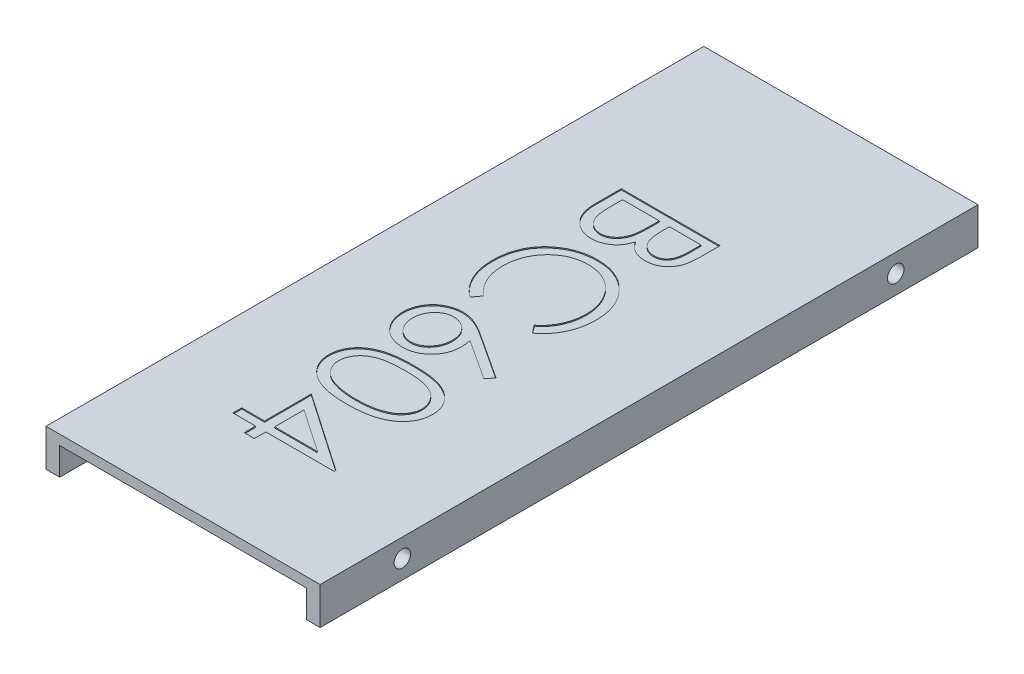
from build123d import *

# Parameters (mm, degrees)
BOSS_EXTRUDE1_DEPTH     = 1200
CUT_EXTRUDE1_DEPTH      = 1239.388983667
CUT_EXTRUDE1_DEPTH_BACK = 1239.388983667
SKETCH4_R               = 15
CUT_EXTRUDE2_DEPTH      = 1239.388983667
CUT_EXTRUDE2_DEPTH_BACK = 1239.388983667
SKETCH4_3_R             = 15
CUT_EXTRUDE3_DEPTH      = 2
CUT_EXTRUDE4_DEPTH      = 2


with BuildPart() as part:
    # Sketch2 → Boss-Extrude1 (new body)
    with BuildSketch(Plane.XY):
        Polygon((-251.282051282, 174.541128592), (248.717948718, 174.541128592), (248.717948718, 156.541128592), (248.717948718, 106.541128592), (223.717948718, 106.541128592), (223.717948718, 156.541128592), (-226.282051282, 156.541128592), (-226.282051282, 106.541128592), (-251.282051282, 106.541128592), (-251.282051282, 156.541128592), align=None)
    extrude(amount=BOSS_EXTRUDE1_DEPTH)

    # Sketch4 → Cut-Extrude1 (cut, two sides: drawn at the far end of the back side and taken through both)
    with BuildSketch(Plane(origin=(0, 0, 0), x_dir=(0, 0, -1), z_dir=(1, 0, 0)).offset(-CUT_EXTRUDE1_DEPTH_BACK)):
        with Locations((-1050, 140.541128592)):
            Circle(SKETCH4_R)
    extrude(amount=CUT_EXTRUDE1_DEPTH + CUT_EXTRUDE1_DEPTH_BACK, mode=Mode.SUBTRACT)

    # Sketch4<3> → Cut-Extrude2 (cut, two sides: drawn at the far end of the back side and taken through both)
    with BuildSketch(Plane(origin=(0, 0, 0), x_dir=(0, 0, -1), z_dir=(1, 0, 0)).offset(-CUT_EXTRUDE2_DEPTH_BACK)):
        with Locations((-150, 140.541128592)):
            Circle(SKETCH4_3_R)
    extrude(amount=CUT_EXTRUDE2_DEPTH + CUT_EXTRUDE2_DEPTH_BACK, mode=Mode.SUBTRACT)

    # Sketch10 → Cut-Extrude3 (cut)
    # profile 1 of 5: a face of its own
    with BuildSketch(Plane(origin=(0, 174.541128592, 0), x_dir=(1, 0, 0), z_dir=(0, 1, 0))):
        with BuildLine():
            Line((78.146190481, -300.04491907), (78.146190481, -335.165111378))
            add(Edge.make_bspline(
                [(78.146190481, -335.165111378), (78.137151889, -336.884290256), (78.119632848, -340.216486787), (77.84792896, -345.062058082), (77.477454509, -349.600568343), (76.889621173, -353.833333778), (76.180329777, -357.758398473), (75.321379235, -361.387591245), (74.291439104, -364.709371533), (72.653630355, -368.675169405), (70.219867411, -373.196803393), (66.623541204, -378.092720732), (62.224728815, -382.279224471), (57.262763679, -385.8888065), (51.80435256, -388.758578366), (45.97959428, -390.834713657), (39.863618981, -392.149118675), (35.664826976, -392.284295292), (33.542825096, -392.352611378)],
                knots=[0, 0, 0, 0, 1.001505555, 1.941167018, 2.826882275, 3.653841531, 4.429895133, 5.150066043, 5.825578002, 6.45369114, 7.647487171, 8.808567382, 9.977351308, 11.170798116, 12.373658725, 13.556498008, 14.765093433, 16, 16, 16, 16], degree=3))
            add(Edge.make_bspline(
                [(33.542825096, -392.352611378), (31.554642564, -392.297475334), (27.647676393, -392.189127808), (21.942511139, -391.117785689), (16.489305649, -389.522710094), (11.355286662, -387.20713163), (6.606437457, -384.228581148), (2.270980235, -380.644239428), (-1.546018812, -376.376612054), (-3.671033142, -373.174069448), (-4.750444135, -371.547322916)],
                knots=[0, 0, 0, 0, 1.044266239, 2.052081639, 3.041743201, 4.026043445, 5.00270663, 5.980942822, 6.97441044, 8, 8, 8, 8], degree=3))
            add(Edge.make_bspline(
                [(-4.750444135, -371.547322916), (-5.534895397, -373.592487364), (-7.035744986, -377.505393579), (-9.703667422, -382.8939412), (-12.572726976, -387.555154482), (-15.722466917, -391.494164039), (-19.160007854, -394.812170025), (-22.81651492, -397.791808261), (-26.872003078, -400.288077055), (-31.210995112, -402.432582364), (-35.803037831, -404.120285559), (-40.627130054, -405.314446312), (-45.629329694, -406.048199974), (-49.038837045, -406.148254614), (-50.760059519, -406.198765224)],
                knots=[0, 0, 0, 0, 1.272302504, 2.434229863, 3.488457646, 4.447234501, 5.35599188, 6.26022912, 7.18267843, 8.11661068, 9.06895546, 10.019249207, 11.000057067, 12, 12, 12, 12], degree=3))
            add(Edge.make_bspline(
                [(-50.760059519, -406.198765224), (-52.517202979, -406.148511661), (-55.974431963, -406.049636369), (-61.053409765, -405.320605874), (-65.906455435, -404.085024166), (-70.568074829, -402.387267407), (-75.01188155, -400.158891413), (-79.293530547, -397.505476298), (-83.298961583, -394.275933825), (-87.123428233, -390.676151579), (-90.560058808, -386.59901095), (-93.619614283, -382.200733576), (-96.147328006, -377.418057754), (-98.244128296, -372.325150131), (-99.869137809, -366.888168175), (-100.997294776, -361.127270907), (-101.75921832, -355.041206432), (-101.821744111, -350.864674882), (-101.853809519, -348.722803685)],
                knots=[0, 0, 0, 0, 0.978404568, 1.925038397, 2.85041836, 3.763147166, 4.682162379, 5.614488577, 6.562659439, 7.54271123, 8.535210642, 9.526693784, 10.520907202, 11.541451354, 12.589717429, 13.675358278, 14.807842563, 16, 16, 16, 16], degree=3))
            Line((-101.853809519, -348.722803685), (-101.853809519, -300.04491907))
            Line((-101.853809519, -300.04491907), (78.146190481, -300.04491907))
        make_face()
        with BuildLine():
            Line((59.684652019, -316.198765224), (1.992344327, -316.198765224))
            Line((1.992344327, -316.198765224), (1.992344327, -327.052130608))
            add(Edge.make_bspline(
                [(1.992344327, -327.052130608), (2.012740642, -328.63865437), (2.05215048, -331.704141593), (2.168599084, -336.155247993), (2.480381589, -340.276595815), (2.810143025, -344.082386479), (3.317908156, -347.547111925), (3.939270014, -350.682371106), (4.590672086, -353.516328478), (5.701591112, -356.783018278), (7.326766392, -360.487401204), (9.908212222, -364.411314459), (12.899379515, -367.926728046), (16.414448564, -370.862054075), (20.252125245, -373.284211145), (24.412751665, -374.90065365), (28.733898368, -376.047175078), (31.708191118, -376.147717563), (33.218305865, -376.198765224)],
                knots=[0, 0, 0, 0, 1.156481963, 2.23455883, 3.244418989, 4.168404366, 5.01828131, 5.794834307, 6.498111525, 7.13526334, 8.307595709, 9.435046769, 10.546766856, 11.659452936, 12.760769924, 13.837671619, 14.902137667, 16, 16, 16, 16], degree=3))
            add(Edge.make_bspline(
                [(33.218305865, -376.198765224), (34.217816075, -376.173234142), (36.178464499, -376.123152137), (39.025629028, -375.667346349), (41.737653684, -375.005967717), (44.25216376, -373.972692522), (46.640628838, -372.72324923), (48.796961191, -371.097950265), (50.839297556, -369.262436648), (52.692648407, -367.106804568), (54.353258025, -364.641491722), (55.814448831, -361.843008211), (56.967077926, -358.677938688), (58.001047584, -355.218047551), (58.718509843, -351.407962296), (59.318403841, -347.28491266), (59.623346562, -342.813921557), (59.663761065, -339.720753874), (59.684652019, -338.121842147)],
                knots=[0, 0, 0, 0, 0.911752476, 1.788502045, 2.626783689, 3.45400582, 4.26402138, 5.080402872, 5.911472738, 6.767166405, 7.66795952, 8.620018292, 9.640966946, 10.73819047, 11.913090943, 13.176185384, 14.540321519, 16, 16, 16, 16], degree=3))
            Line((59.684652019, -338.121842147), (59.684652019, -316.198765224))
        make_face(mode=Mode.SUBTRACT)
        with BuildLine():
            Line((-16.469194135, -316.198765224), (-83.392271058, -316.198765224))
            Line((-83.392271058, -316.198765224), (-83.392271058, -339.203572916))
            add(Edge.make_bspline(
                [(-83.392271058, -339.203572916), (-83.372604407, -340.850268699), (-83.33469953, -344.024057733), (-83.20960499, -348.606298043), (-82.931038039, -352.84187125), (-82.476899615, -356.733214658), (-82.005010221, -360.31458269), (-81.351892482, -363.550394358), (-80.60937658, -366.445610416), (-79.460298051, -369.802260223), (-77.678231305, -373.58449046), (-74.97375424, -377.657571628), (-71.79421265, -381.315031314), (-68.067907037, -384.385285533), (-64.046862306, -386.920581078), (-59.752109883, -388.698731772), (-55.31466984, -389.842057189), (-52.28131926, -389.977162316), (-50.760059519, -390.04491907)],
                knots=[0, 0, 0, 0, 1.159821618, 2.235403267, 3.228114831, 4.14795534, 4.994323282, 5.771256229, 6.471395042, 7.097801288, 8.267864287, 9.404187171, 10.531774336, 11.667624178, 12.792825787, 13.866573821, 14.930062559, 16, 16, 16, 16], degree=3))
            add(Edge.make_bspline(
                [(-50.760059519, -390.04491907), (-49.808850388, -390.0310698), (-47.921775214, -390.003594651), (-45.150755565, -389.573654821), (-42.454582343, -388.973860711), (-39.87402563, -388.105307285), (-37.367094245, -387.010131795), (-34.977455008, -385.635728108), (-32.647970771, -384.04855224), (-29.706360083, -381.565684728), (-26.315971326, -377.957718928), (-22.997023822, -372.829647938), (-20.320244429, -366.999155628), (-19.183704921, -362.770301313), (-18.596597981, -360.585784455)],
                knots=[0, 0, 0, 0, 0.723503378, 1.435336582, 2.130201219, 2.824764462, 3.504949994, 4.209866579, 4.920640069, 5.648298893, 7.13757748, 8.670694625, 10.280166878, 12, 12, 12, 12], degree=3))
            add(Edge.make_bspline(
                [(-18.596597981, -360.585784455), (-18.418896005, -359.7100032), (-18.033601468, -357.811128796), (-17.627149259, -354.714723215), (-17.262548395, -351.167882191), (-16.999933916, -347.185765547), (-16.718021857, -342.752535892), (-16.612287641, -337.869617446), (-16.483233445, -332.533558181), (-16.473993617, -328.831088783), (-16.469194135, -326.907899839)],
                knots=[0, 0, 0, 0, 0.634452549, 1.375623993, 2.216454381, 3.166361212, 4.209414599, 5.370755378, 6.634280627, 8, 8, 8, 8], degree=3))
            Line((-16.469194135, -326.907899839), (-16.469194135, -316.198765224))
        make_face(mode=Mode.SUBTRACT)
    # profile 2 of 5: a face of its own
    with BuildSketch(Plane(origin=(0, 174.541128592, 0), x_dir=(1, 0, 0), z_dir=(0, 1, 0))):
        with BuildLine():
            Line((45.117344327, -609.275688301), (34.300036634, -595.141072916))
            add(Edge.make_bspline(
                [(34.300036634, -595.141072916), (35.501715083, -594.132770086), (37.888870749, -592.129758535), (41.240961607, -588.907285263), (44.381460766, -585.548915057), (47.325328862, -582.05593168), (49.969619671, -578.365462678), (52.452133536, -574.566907318), (54.677331488, -570.596722136), (57.375427917, -565.106632925), (60.19094446, -557.924743585), (62.55168207, -548.883866147), (64.054485391, -539.446152511), (64.217248666, -533.007418816), (64.300036634, -529.73241907)],
                knots=[0, 0, 0, 0, 0.757959112, 1.505699292, 2.245454638, 2.979532153, 3.711538275, 4.438200793, 5.171680507, 5.909471876, 7.393775596, 8.890124382, 10.418191784, 12, 12, 12, 12], degree=3))
            add(Edge.make_bspline(
                [(64.300036634, -529.73241907), (64.279167677, -527.928157036), (64.237623446, -524.33637822), (63.693394735, -519.005561632), (62.919665439, -513.764191366), (61.799531636, -508.631758221), (60.34121905, -503.618452877), (58.631007645, -498.686103166), (56.502823112, -493.892799003), (54.15252742, -489.180854209), (51.497125227, -484.666703207), (48.601683077, -480.394635806), (45.494619312, -476.38416906), (42.183954184, -472.624189863), (38.628542794, -469.155934515), (34.870210343, -465.923819049), (30.863720628, -462.986093805), (26.684211993, -460.270569302), (22.325541372, -457.854238175), (17.815128438, -455.767619253), (13.170218131, -453.979213346), (8.381295054, -452.550972436), (3.467204783, -451.424429607), (-1.582481489, -450.646162626), (-6.757962051, -450.106829751), (-10.2658649, -450.065667685), (-12.034097981, -450.04491907)],
                knots=[0, 0, 0, 0, 1.055000685, 2.100209969, 3.131349012, 4.153242145, 5.170189196, 6.184191144, 7.204341339, 8.235672124, 9.263040994, 10.265373269, 11.252624173, 12.22887325, 13.193405896, 14.155809299, 15.126090485, 16.097288279, 17.069732292, 18.038585918, 19.002221264, 19.978698174, 20.959418239, 21.948869816, 22.966084182, 24, 24, 24, 24], degree=3))
            add(Edge.make_bspline(
                [(-12.034097981, -450.04491907), (-14.694565863, -450.10981262), (-19.918041655, -450.237222497), (-27.569101626, -451.371136821), (-34.898736277, -453.094255802), (-41.861128167, -455.676771187), (-48.542129439, -458.861179502), (-54.828699043, -462.884982379), (-60.815836646, -467.545261443), (-66.362045388, -472.907945873), (-71.428465546, -478.791673552), (-75.889924023, -485.104423291), (-79.608975122, -491.830472377), (-82.703738085, -498.895556216), (-85.082655508, -506.354042074), (-86.757381859, -514.192517627), (-87.849836859, -522.393934526), (-87.954426531, -527.998075091), (-88.007655673, -530.850207531)],
                knots=[0, 0, 0, 0, 1.029171465, 2.020641659, 2.987623507, 3.938342917, 4.889210282, 5.84687017, 6.821220943, 7.821438502, 8.827599549, 9.822697543, 10.807740252, 11.797342354, 12.80366471, 13.83203677, 14.896651826, 16, 16, 16, 16], degree=3))
            add(Edge.make_bspline(
                [(-88.007655673, -530.850207531), (-87.920804143, -533.992631537), (-87.749859555, -540.17767371), (-86.301669601, -549.24802935), (-83.953548112, -557.931011583), (-80.66736925, -566.227087462), (-76.395440158, -574.112869267), (-71.216692177, -581.600697511), (-65.081863635, -588.696892566), (-60.397588467, -592.963987081), (-58.007655673, -595.141072916)],
                knots=[0, 0, 0, 0, 1.028121516, 2.023589091, 2.998037872, 3.967518031, 4.937445131, 5.927275754, 6.942489185, 8, 8, 8, 8], degree=3))
            Line((-58.007655673, -595.141072916), (-68.716790289, -609.275688301))
            add(Edge.make_bspline(
                [(-68.716790289, -609.275688301), (-70.18448461, -608.138187017), (-73.112843081, -605.868633016), (-77.241065231, -602.193626891), (-81.12426891, -598.322306683), (-84.730315127, -594.225416046), (-88.134483836, -589.951953824), (-91.222653001, -585.426645115), (-94.088893191, -580.727650794), (-96.67865269, -575.827612616), (-99.000656278, -570.742618054), (-100.960955906, -565.477958976), (-102.673892145, -560.078237869), (-104.07378911, -554.540735401), (-105.168174621, -548.846952304), (-105.899350278, -543.016424078), (-106.40039593, -537.036843103), (-106.446055673, -533.00271115), (-106.469194135, -530.958380608)],
                knots=[0, 0, 0, 0, 0.986756325, 1.968786143, 2.935506311, 3.899499537, 4.868307269, 5.8376204, 6.809456583, 7.792545619, 8.781780509, 9.778496008, 10.776623214, 11.79151764, 12.812666265, 13.856269958, 14.913646641, 16, 16, 16, 16], degree=3))
            add(Edge.make_bspline(
                [(-106.469194135, -530.958380608), (-106.455720232, -529.022420588), (-106.429077257, -525.194299383), (-105.997480076, -519.542363586), (-105.408636464, -514.040042288), (-104.522001152, -508.703061529), (-103.475720806, -503.502297098), (-102.073199037, -498.48489561), (-100.502099041, -493.601484791), (-98.655556865, -488.871684413), (-96.571867478, -484.29147128), (-94.21687302, -479.875618124), (-91.610377123, -475.626155887), (-88.80983373, -471.501305671), (-85.725286776, -467.562001368), (-82.399574145, -463.774105779), (-78.84390502, -460.11637843), (-76.279941134, -457.853383201), (-74.99082875, -456.715592147)],
                knots=[0, 0, 0, 0, 1.114604814, 2.203992996, 3.262667896, 4.300477797, 5.318619304, 6.316056647, 7.298880507, 8.271930387, 9.238335007, 10.195173496, 11.151986948, 12.108099108, 13.064862484, 14.031167946, 15.010108607, 16, 16, 16, 16], degree=3))
            add(Edge.make_bspline(
                [(-74.99082875, -456.715592147), (-72.751567606, -454.893187624), (-68.300079642, -451.270380244), (-61.085372034, -446.63534509), (-53.552721292, -442.667756537), (-45.662553526, -439.459852039), (-37.432573611, -436.952054334), (-28.85863287, -435.21473573), (-19.9487387, -434.085796071), (-13.888560997, -433.956695506), (-10.808136442, -433.891072916)],
                knots=[0, 0, 0, 0, 0.994628077, 1.977248131, 2.950237994, 3.925870899, 4.908910175, 5.911660606, 6.938484602, 8, 8, 8, 8], degree=3))
            add(Edge.make_bspline(
                [(-10.808136442, -433.891072916), (-7.570562862, -433.971412034), (-1.200838964, -434.129474233), (8.149469143, -435.461295021), (17.094834897, -437.629756552), (25.669677939, -440.61574253), (33.824936266, -444.555056397), (41.595052984, -449.323914415), (48.973683569, -454.968896804), (55.866491537, -461.419107975), (62.168347484, -468.494372232), (67.712710432, -476.070670924), (72.326742537, -484.133768177), (76.183691139, -492.594679369), (79.148262686, -501.516802008), (81.223569662, -510.881089047), (82.515307007, -520.669947664), (82.678603422, -527.348586678), (82.761575096, -530.742034455)],
                knots=[0, 0, 0, 0, 1.032901378, 2.032168977, 3.007206631, 3.966850309, 4.924221947, 5.891988639, 6.871730993, 7.884084801, 8.900290346, 9.89161143, 10.874607481, 11.860025555, 12.854717796, 13.869097222, 14.917278314, 16, 16, 16, 16], degree=3))
            add(Edge.make_bspline(
                [(82.761575096, -530.742034455), (82.736797947, -532.81021135), (82.687754075, -536.903959231), (82.208883891, -542.959751189), (81.412028747, -548.855858238), (80.320283323, -554.606539297), (78.982169408, -560.232647513), (77.230474882, -565.67646323), (75.196328111, -570.967630063), (72.913290121, -576.110110809), (70.303254603, -581.047956815), (67.468482434, -585.780269476), (64.3435376, -590.249962094), (61.031730866, -594.541109885), (57.409178914, -598.557105531), (53.593852962, -602.412644874), (49.472538922, -605.974543062), (46.571733337, -608.173292242), (45.117344327, -609.275688301)],
                knots=[0, 0, 0, 0, 1.096705196, 2.170817488, 3.219277236, 4.250701065, 5.274195539, 6.284202015, 7.28098643, 8.279664616, 9.266225751, 10.241373748, 11.203306326, 12.157093976, 13.114198862, 14.069774147, 15.032234603, 16, 16, 16, 16], degree=3))
        make_face()
    # profile 3 of 5: a face of its own
    with BuildSketch(Plane(origin=(0, 174.541128592, 0), x_dir=(1, 0, 0), z_dir=(0, 1, 0))):
        with BuildLine():
            Line((82.761575096, -713.121842147), (72.989940481, -725.561745993))
            Line((72.989940481, -725.561745993), (0.261575096, -678.001649839))
            add(Edge.make_bspline(
                [(0.261575096, -678.001649839), (0.76628793, -681.168121227), (1.750787378, -687.34468169), (1.913196001, -693.596642185), (1.992344327, -696.643476762)],
                knots=[0, 0, 0, 0, 1.025318673, 2, 2, 2, 2], degree=3))
            add(Edge.make_bspline(
                [(1.992344327, -696.643476762), (1.943172868, -698.472919431), (1.846380315, -702.074122883), (1.101496565, -707.361329852), (-0.072366334, -712.441903702), (-1.783510925, -717.294786618), (-3.969346293, -721.937397114), (-6.589059621, -726.396377485), (-9.777923182, -730.587909433), (-13.340120908, -734.565970078), (-17.285565825, -738.177649373), (-21.471920285, -741.375275087), (-25.894822736, -744.061224376), (-30.552032984, -746.240454631), (-35.436372047, -747.93270553), (-40.541590649, -749.166355847), (-45.871209181, -749.895592049), (-49.495801052, -749.994617286), (-51.336982596, -750.04491907)],
                knots=[0, 0, 0, 0, 1.04369286, 2.054478336, 3.041073146, 4.015093852, 4.984733326, 5.965804835, 6.960378782, 7.985147595, 9.009457201, 10.008161701, 10.986880575, 11.956520048, 12.937015923, 13.931873656, 14.949455224, 16, 16, 16, 16], degree=3))
            add(Edge.make_bspline(
                [(-51.336982596, -750.04491907), (-53.854441391, -749.95098331), (-58.805283657, -749.766248952), (-66.046293554, -748.421461292), (-72.88928098, -746.100658257), (-79.361137747, -742.995702095), (-85.273564803, -738.967265621), (-90.616813447, -734.193346918), (-95.274239575, -728.628819109), (-99.269651438, -722.405451441), (-102.444001132, -715.669834905), (-104.790862653, -708.607320642), (-106.193172054, -701.278275212), (-106.376763565, -696.30084495), (-106.469194135, -693.79491907)],
                knots=[0, 0, 0, 0, 1.031881447, 2.029301251, 3.006342947, 3.987068354, 4.962916383, 5.929513747, 6.915671209, 7.928552063, 8.953527267, 9.960179832, 10.973036711, 12, 12, 12, 12], degree=3))
            add(Edge.make_bspline(
                [(-106.469194135, -693.79491907), (-106.390600895, -691.372802569), (-106.234921447, -686.575013861), (-104.848098883, -679.517334131), (-102.600316013, -672.735781665), (-99.503540328, -666.27802514), (-95.592145916, -660.295460062), (-90.882661509, -654.944848052), (-85.479172119, -650.244805011), (-79.365101818, -646.35400093), (-72.83744487, -643.182985044), (-65.968931821, -640.946421684), (-58.897794221, -639.500030322), (-54.084387944, -639.350803448), (-51.661501827, -639.275688301)],
                knots=[0, 0, 0, 0, 1.011913813, 2.004424092, 2.994488568, 3.992479987, 4.990471406, 5.973328987, 6.963763268, 7.974390938, 8.994854117, 9.989689954, 10.988086187, 12, 12, 12, 12], degree=3))
            add(Edge.make_bspline(
                [(-51.661501827, -639.275688301), (-49.808455351, -639.340922785), (-46.026572179, -639.474059865), (-40.282235291, -640.268606622), (-34.427577709, -641.72590245), (-29.464429832, -643.303015046), (-25.354044175, -644.86798682), (-22.108181202, -646.319064658), (-18.680445681, -647.94154649), (-15.135693741, -649.843321145), (-11.37264414, -651.859355753), (-7.530654094, -654.214312954), (-3.469402263, -656.67174698), (-0.765483878, -658.4720005), (0.622152019, -659.395880608)],
                knots=[0, 0, 0, 0, 1.17367173, 2.395347028, 3.66355231, 4.98980831, 5.690886799, 6.447442954, 7.240630024, 8.091733897, 8.994365608, 9.943299771, 10.944512865, 12, 12, 12, 12], degree=3))
            Line((0.622152019, -659.395880608), (82.761575096, -713.121842147))
        make_face()
        with BuildLine():
            add(Edge.make_bspline(
                [(-16.469194135, -693.254053685), (-16.509737869, -691.882895545), (-16.589284343, -689.192694566), (-17.038563397, -685.25075982), (-17.889824031, -681.530047777), (-18.990949258, -677.988061839), (-20.490208306, -674.661718798), (-22.289744211, -671.513074962), (-24.429274764, -668.573374009), (-26.884944724, -665.894242185), (-29.534275238, -663.434137493), (-32.388946086, -661.318045724), (-35.361742084, -659.490714391), (-38.480603906, -658.005486306), (-41.743530923, -656.848820911), (-45.135730626, -656.012176957), (-48.679892316, -655.546553053), (-51.083278534, -655.469090052), (-52.310540289, -655.429534455)],
                knots=[0, 0, 0, 0, 1.129474985, 2.216020618, 3.260639938, 4.268601163, 5.26556745, 6.258792394, 7.250684778, 8.252748164, 9.247500881, 10.223461414, 11.174097059, 12.117127289, 13.062595836, 14.020469732, 14.98917545, 16, 16, 16, 16], degree=3))
            add(Edge.make_bspline(
                [(-52.310540289, -655.429534455), (-53.526778671, -655.461830331), (-55.911641077, -655.525157738), (-59.426888127, -656.097521169), (-62.806605357, -656.978053767), (-66.053264721, -658.266920178), (-69.149156201, -659.883535512), (-72.116270817, -661.872958936), (-74.956656542, -664.201504707), (-77.598688928, -666.908392964), (-80.022025237, -669.827509512), (-82.179768436, -672.914668609), (-83.991695737, -676.160054287), (-85.424167087, -679.582185027), (-86.597395272, -683.133148326), (-87.423577166, -686.840033285), (-87.890531563, -690.706096954), (-87.968101887, -693.32493519), (-88.007655673, -694.660303685)],
                knots=[0, 0, 0, 0, 0.989642335, 1.94054129, 2.892446913, 3.828371744, 4.778262963, 5.730973156, 6.732161388, 7.763274768, 8.805796303, 9.818398792, 10.825975928, 11.825728216, 12.834635236, 13.867465554, 14.912602056, 16, 16, 16, 16], degree=3))
            add(Edge.make_bspline(
                [(-88.007655673, -694.660303685), (-87.968104988, -695.995674368), (-87.890540746, -698.614516895), (-87.423542266, -702.480549465), (-86.597523333, -706.187549388), (-85.423702866, -709.738094849), (-83.993417846, -713.161767984), (-82.168414642, -716.409994491), (-80.035144462, -719.526627763), (-77.594518075, -722.443829287), (-74.971585259, -725.162031579), (-72.090553083, -727.436037707), (-69.172738401, -729.488311523), (-66.04092776, -731.0428372), (-62.808559822, -732.346057558), (-59.426364533, -733.222147506), (-55.911778155, -733.795695385), (-53.526824968, -733.85886004), (-52.310540289, -733.891072916)],
                knots=[0, 0, 0, 0, 1.087205562, 2.132157158, 3.164804748, 4.173533273, 5.173108684, 6.180507559, 7.20098426, 8.243321352, 9.274252308, 10.269075238, 11.227079059, 12.172305571, 13.108064818, 14.05980203, 15.010532752, 16, 16, 16, 16], degree=3))
            add(Edge.make_bspline(
                [(-52.310540289, -733.891072916), (-51.081535035, -733.863101991), (-48.669397415, -733.808204161), (-45.138923783, -733.175255155), (-41.715946735, -732.320352182), (-38.477574352, -730.938750621), (-35.334252612, -729.29315039), (-32.375819999, -727.196763794), (-29.518463585, -724.79320525), (-26.867373938, -722.009651234), (-24.442471578, -718.981393652), (-22.302088874, -715.761062401), (-20.495647916, -712.392107515), (-18.98842914, -708.877783371), (-17.900740913, -705.177865623), (-17.044288683, -701.35207622), (-16.588527698, -697.351486743), (-16.509478643, -694.637261153), (-16.469194135, -693.254053685)],
                knots=[0, 0, 0, 0, 0.978265087, 1.920016216, 2.851775529, 3.783928695, 4.718195979, 5.674835085, 6.667117013, 7.690134047, 8.732874136, 9.755756613, 10.767227014, 11.776017537, 12.797239016, 13.836276431, 14.897336092, 16, 16, 16, 16], degree=3))
        make_face(mode=Mode.SUBTRACT)
    # profile 4 of 5: a face of its own
    with BuildSketch(Plane(origin=(0, 174.541128592, 0), x_dir=(1, 0, 0), z_dir=(0, 1, 0))):
        with BuildLine():
            add(Edge.make_bspline(
                [(-11.925924904, -768.506457531), (-9.040916391, -768.523327036), (-3.436745771, -768.556096291), (4.729321525, -768.920643665), (12.390136423, -769.52623266), (19.546065414, -770.356154823), (26.198956564, -771.366107651), (32.33102843, -772.71433416), (37.970669891, -774.247559035), (43.136245665, -776.024558682), (47.897437335, -778.029587397), (52.341976272, -780.212123857), (56.464219827, -782.657593297), (60.326095078, -785.23040845), (63.884501668, -788.024586816), (67.132700833, -791.010656681), (70.0726539, -794.21823868), (72.739351299, -797.583894131), (75.062384683, -801.128893032), (77.155592175, -804.743954903), (78.873615561, -808.492870426), (80.285279434, -812.341448317), (81.416409924, -816.278496493), (82.199715599, -820.32028254), (82.690637684, -824.467782892), (82.737704951, -827.267082398), (82.761575096, -828.686745993)],
                knots=[0, 0, 0, 0, 1.646377244, 3.198111528, 4.663803227, 6.031090796, 7.308794487, 8.502186765, 9.612154809, 10.642545331, 11.617106989, 12.558866172, 13.465886467, 14.35053239, 15.20542558, 16.045215227, 16.865619885, 17.686225247, 18.492864914, 19.282407821, 20.068097601, 20.842842034, 21.620163247, 22.403093475, 23.190129512, 24, 24, 24, 24], degree=3))
            add(Edge.make_bspline(
                [(82.761575096, -828.686745993), (82.736487458, -830.118284887), (82.68659604, -832.965165344), (82.207078996, -837.174098928), (81.411421237, -841.285796845), (80.284056829, -845.282729692), (78.88542203, -849.197728996), (77.132370293, -853.000172818), (75.091742829, -856.713679874), (72.693943425, -860.279237518), (70.020569221, -863.735989164), (66.998489111, -866.99902726), (63.658217834, -870.068648821), (60.035493406, -872.983378812), (56.0608319, -875.660523811), (51.803363395, -878.210014611), (47.188633206, -880.492005029), (42.293637717, -882.689788324), (36.982935264, -884.586833356), (31.286461866, -886.297668827), (25.136932256, -887.680015783), (18.56661107, -888.831464074), (11.551369074, -889.723487295), (4.106244277, -890.37316603), (-3.773661528, -890.716353261), (-9.161208057, -890.780983608), (-11.925924904, -890.814149839)],
                knots=[0, 0, 0, 0, 0.810914788, 1.612654377, 2.396697861, 3.181598691, 3.963628158, 4.749916497, 5.551656086, 6.361998678, 7.18212741, 8.025565596, 8.878627764, 9.750805457, 10.657531673, 11.591944965, 12.560506719, 13.57287815, 14.630710178, 15.753379473, 16.941251878, 18.199788006, 19.531962791, 20.947069417, 22.433333509, 24, 24, 24, 24], degree=3))
            add(Edge.make_bspline(
                [(-11.925924904, -890.814149839), (-14.678572734, -890.78059836), (-20.041994776, -890.715224672), (-27.88658713, -890.377463381), (-35.291701215, -889.709009198), (-42.27795005, -888.882236851), (-48.803854028, -887.704511036), (-54.931466603, -886.365644343), (-60.607907463, -884.701576773), (-65.890601706, -882.830388541), (-70.761614884, -880.680294965), (-75.336452911, -878.378135978), (-79.590447486, -875.844294475), (-83.565051212, -873.151183586), (-87.21919408, -870.261228446), (-90.561907153, -867.178608848), (-93.590985617, -863.900978433), (-96.300886497, -860.436411441), (-98.670773835, -856.814762553), (-100.789071936, -853.113650734), (-102.507939476, -849.259205087), (-103.959212673, -845.337087579), (-105.089170627, -841.310290462), (-105.862845211, -837.182763485), (-106.406956554, -832.968024142), (-106.44837644, -830.118780159), (-106.469194135, -828.686745993)],
                knots=[0, 0, 0, 0, 1.56130642, 3.042141888, 4.451772327, 5.777565838, 7.030558081, 8.211376819, 9.333164717, 10.383253789, 11.387583522, 12.350962576, 13.286244149, 14.193812918, 15.072134482, 15.925989337, 16.770211267, 17.600669898, 18.417446232, 19.22325363, 20.01647746, 20.807971184, 21.593601364, 22.38506573, 23.188331689, 24, 24, 24, 24], degree=3))
            add(Edge.make_bspline(
                [(-106.469194135, -828.686745993), (-106.44509429, -827.267140074), (-106.397574101, -824.467954292), (-105.909969827, -820.31962087), (-105.114851547, -816.284138394), (-104.035084871, -812.353439645), (-102.662765453, -808.519480354), (-100.917225991, -804.819817947), (-98.892671765, -801.205592615), (-96.589362463, -797.693296161), (-93.949829984, -794.349870878), (-91.030585459, -791.156160873), (-87.758408291, -788.192806105), (-84.18567468, -785.4336477), (-80.342699297, -782.81535619), (-76.191625944, -780.393850568), (-71.705444309, -778.215571245), (-66.917969363, -776.165608174), (-61.714429194, -774.358569602), (-56.0447082, -772.774417021), (-49.877442839, -771.453804236), (-43.230941874, -770.391760598), (-36.100230665, -769.516212462), (-28.472754207, -768.923511203), (-20.355093279, -768.555805968), (-14.786920331, -768.523207185), (-11.925924904, -768.506457531)],
                knots=[0, 0, 0, 0, 0.810940842, 1.599017053, 2.38298203, 3.159479784, 3.926441347, 4.70693857, 5.494146311, 6.292334103, 7.104379492, 7.925868426, 8.762126819, 9.623561095, 10.503686106, 11.41783325, 12.366995289, 13.351843594, 14.392337808, 15.512229747, 16.713911458, 17.994391108, 19.357476964, 20.818259213, 22.365182633, 24, 24, 24, 24], degree=3))
        make_face()
        with BuildLine():
            add(Edge.make_bspline(
                [(-11.853809519, -784.660303685), (-14.258028316, -784.666446676), (-18.924144907, -784.678369016), (-25.70465546, -784.989830773), (-32.028843838, -785.414128375), (-37.90473987, -785.961395232), (-43.312455232, -786.774117817), (-48.289180352, -787.68475422), (-52.808585839, -788.792936426), (-56.901657683, -790.104126113), (-60.637948534, -791.597506286), (-64.114397163, -793.228300001), (-67.373152545, -794.979263675), (-70.38111652, -796.942279638), (-73.168231252, -799.072822435), (-75.726487311, -801.374390574), (-78.044722407, -803.842936279), (-80.795533111, -807.260212746), (-83.671753533, -811.749436862), (-86.145522694, -817.434702666), (-87.710189638, -823.279116814), (-87.908615283, -827.247078629), (-88.007655673, -829.227611378)],
                knots=[0, 0, 0, 0, 1.459116078, 2.831857795, 4.118796693, 5.306371758, 6.412361096, 7.436813035, 8.376339383, 9.234574298, 10.043323891, 10.816788787, 11.564361537, 12.286735248, 12.994408768, 13.691741332, 14.372975427, 15.047457468, 16.352811911, 17.594285292, 18.799233213, 20, 20, 20, 20], degree=3))
            add(Edge.make_bspline(
                [(-88.007655673, -829.227611378), (-87.925484089, -831.220863063), (-87.761310573, -835.203251112), (-86.177375508, -841.021560577), (-83.787513479, -846.669974467), (-80.961641771, -851.096531395), (-78.270470542, -854.464205061), (-75.976002915, -856.877078838), (-73.406844025, -859.091698472), (-70.634880235, -861.192148036), (-67.607152477, -863.118614785), (-64.338220035, -864.870433295), (-60.819005171, -866.469005454), (-58.362275731, -867.379756389), (-57.106213366, -867.845399839)],
                knots=[0, 0, 0, 0, 1.353760809, 2.704726607, 4.075137775, 5.516104923, 6.260822281, 7.007110065, 7.778089737, 8.566572457, 9.372053459, 10.217411131, 11.088608312, 12, 12, 12, 12], degree=3))
            add(Edge.make_bspline(
                [(-57.106213366, -867.845399839), (-55.500112479, -868.388062183), (-52.239038889, -869.489899466), (-47.180336782, -870.909933571), (-41.872766065, -872.028268387), (-36.348045777, -873.03438434), (-30.565432582, -873.721112929), (-24.542818552, -874.273857612), (-18.27566278, -874.599435798), (-14.017634661, -874.639794424), (-11.853809519, -874.660303685)],
                knots=[0, 0, 0, 0, 0.884706709, 1.796334032, 2.740027952, 3.714592787, 4.726048262, 5.777819803, 6.87074269, 8, 8, 8, 8], degree=3))
            add(Edge.make_bspline(
                [(-11.853809519, -874.660303685), (-9.690030886, -874.637684164), (-5.456693722, -874.593430072), (0.736682382, -874.302676682), (6.629334243, -873.835460148), (12.226607516, -873.20309282), (17.518539692, -872.334986204), (22.512703426, -871.292476564), (27.207752376, -870.070253629), (31.615794644, -868.668327487), (35.720986568, -867.088376131), (39.532265954, -865.343003615), (43.069837943, -863.480454656), (46.323548345, -861.457068118), (49.308083659, -859.297308079), (51.96357594, -856.944058129), (54.372334592, -854.490691537), (57.121838056, -851.054378765), (59.925296723, -846.555701171), (62.505250075, -840.957924972), (63.986819413, -835.132577566), (64.195706174, -831.194514211), (64.300036634, -829.227611378)],
                knots=[0, 0, 0, 0, 1.313668642, 2.570134578, 3.763346207, 4.902004944, 5.98888779, 7.017888835, 7.998425394, 8.933058446, 9.82474457, 10.667209444, 11.476765193, 12.250262638, 12.991704352, 13.7104269, 14.401925311, 15.076585796, 16.378385137, 17.609787933, 18.806186071, 20, 20, 20, 20], degree=3))
            add(Edge.make_bspline(
                [(64.300036634, -829.227611378), (64.195696834, -827.236697333), (63.986827151, -823.251242276), (62.50913513, -817.366613796), (59.949316687, -811.728961994), (57.103734259, -807.266376862), (54.421008556, -803.834399649), (52.088100096, -801.410944589), (49.522104894, -799.145266442), (46.746790103, -797.012948645), (43.73730903, -795.051822374), (40.479027541, -793.300142124), (37.002255851, -791.670284519), (33.266815077, -790.173698155), (29.167572687, -788.874659777), (24.670976176, -787.713559092), (19.689602592, -786.803475164), (14.266768716, -786.00929738), (8.383649337, -785.403781863), (2.04488074, -784.990919991), (-4.747355464, -784.677805475), (-9.437547301, -784.666254461), (-11.853809519, -784.660303685)],
                knots=[0, 0, 0, 0, 1.207964612, 2.418129846, 3.655795183, 4.951004962, 5.620895151, 6.296795572, 6.989224116, 7.696855977, 8.419187164, 9.166715907, 9.940135271, 10.748837255, 11.607021648, 12.548275234, 13.5654991, 14.678641405, 15.874140913, 17.15372626, 18.533675393, 20, 20, 20, 20], degree=3))
        make_face(mode=Mode.SUBTRACT)
    # profile 5 of 5: a face of its own
    with BuildSketch(Plane(origin=(0, 174.541128592, 0), x_dir=(1, 0, 0), z_dir=(0, 1, 0))):
        Polygon((82.761575096, -1005.225207531), (82.761575096, -1008.506457531), (-41.853809519, -1008.506457531), (-41.853809519, -1029.275688301), (-60.315347981, -1029.275688301), (-60.315347981, -1008.506457531), (-101.853809519, -1008.506457531), (-101.853809519, -992.352611378), (-60.315347981, -992.352611378), (-60.315347981, -906.967995993), align=None)
        Polygon((-41.853809519, -992.352611378), (36.319267404, -992.352611378), (-41.853809519, -938.698765224), align=None, mode=Mode.SUBTRACT)
    extrude(amount=-CUT_EXTRUDE3_DEPTH, mode=Mode.SUBTRACT)

    # Sketch12 → Cut-Extrude4 (cut)
    # profile 1 of 5: a face of its own
    with BuildSketch(Plane(origin=(0, 156.541128592, 0), x_dir=(-1, 0, 0), z_dir=(0, -1, 0))):
        with BuildLine():
            Line((-85.454847818, -978.891072916), (-85.454847818, -943.770880608))
            add(Edge.make_bspline(
                [(-85.454847818, -943.770880608), (-85.44595152, -942.051674618), (-85.428708281, -938.719425535), (-85.155070578, -933.874222708), (-84.791295139, -929.334436023), (-84.181081405, -925.108087846), (-83.548370259, -921.167677966), (-82.619701769, -917.553209815), (-81.593953575, -914.234407732), (-80.015700782, -910.249205728), (-77.564654301, -905.727447989), (-73.929519454, -900.867404502), (-69.571286314, -896.642758161), (-64.604735877, -893.050556519), (-59.140967593, -890.167738277), (-53.297536193, -888.108531358), (-47.172750419, -886.78561841), (-42.973643477, -886.651275402), (-40.851482434, -886.583380608)],
                knots=[0, 0, 0, 0, 1.00128172, 1.940733171, 2.826250472, 3.653024905, 4.427672124, 5.149348099, 5.824709082, 6.450061444, 7.643590664, 8.808605388, 9.972104426, 11.165284501, 12.367876273, 13.557044126, 14.765369432, 16, 16, 16, 16], degree=3))
            add(Edge.make_bspline(
                [(-40.851482434, -886.583380608), (-38.863724116, -886.639932017), (-34.957591566, -886.751060868), (-29.254274051, -887.800767915), (-23.830752496, -889.466803023), (-18.691668625, -891.769330747), (-13.932686923, -894.736008886), (-9.568549432, -898.290506303), (-5.764196531, -902.561206545), (-3.63814901, -905.762537833), (-2.558213203, -907.38866907)],
                knots=[0, 0, 0, 0, 1.044641374, 2.052818814, 3.038628718, 4.023282556, 5.005660861, 5.98021751, 6.974042014, 8, 8, 8, 8], degree=3))
            add(Edge.make_bspline(
                [(-2.558213203, -907.38866907), (-1.772901907, -905.34404453), (-0.270406862, -901.432171295), (2.381833299, -896.045757577), (5.277006963, -891.421943967), (8.389835748, -887.470406608), (11.794619514, -884.10867118), (15.519020577, -881.197213907), (19.559989905, -878.680202365), (23.902675675, -876.53824295), (28.510262949, -874.855707122), (33.326474604, -873.619066606), (38.332847694, -872.887566864), (41.730272726, -872.787779077), (43.451402182, -872.737226762)],
                knots=[0, 0, 0, 0, 1.272586185, 2.434772614, 3.483318042, 4.437947805, 5.351807173, 6.25737843, 7.180033415, 8.1141739, 9.066731021, 10.025721652, 10.999834114, 12, 12, 12, 12], degree=3))
            add(Edge.make_bspline(
                [(43.451402182, -872.737226762), (45.208562756, -872.787453577), (48.665825414, -872.886276241), (53.744558771, -873.615688776), (58.598502812, -874.849866428), (63.256816896, -876.552789029), (67.709734175, -878.760060175), (71.94112322, -881.485059962), (75.959787375, -884.689534859), (79.772819097, -888.311109465), (83.261862982, -892.347071037), (86.261264092, -896.794960459), (88.840321583, -901.532927216), (90.940098226, -906.621541722), (92.560074506, -912.047813775), (93.6887524, -917.808723921), (94.450529936, -923.894784786), (94.513076249, -928.071316844), (94.545152182, -930.213188301)],
                knots=[0, 0, 0, 0, 0.978680899, 1.925582087, 2.851223405, 3.764209995, 4.683484765, 5.614004905, 6.562443559, 7.542772147, 8.539900013, 9.527881485, 10.525548727, 11.540192123, 12.58875426, 13.674701727, 14.807505862, 16, 16, 16, 16], degree=3))
            Line((94.545152182, -930.213188301), (94.545152182, -978.891072916))
            Line((94.545152182, -978.891072916), (-85.454847818, -978.891072916))
        make_face()
        with BuildLine():
            Line((-66.993309357, -962.737226762), (-9.301001664, -962.737226762))
            Line((-9.301001664, -962.737226762), (-9.301001664, -951.883861378))
            add(Edge.make_bspline(
                [(-9.301001664, -951.883861378), (-9.32156913, -950.297351898), (-9.361309666, -947.231892273), (-9.475147726, -942.792583353), (-9.793904109, -938.671867974), (-10.112569467, -934.876859942), (-10.630689649, -931.413532543), (-11.247432211, -928.289568122), (-11.899680328, -925.455907873), (-13.009033976, -922.188236319), (-14.648011163, -918.481108483), (-17.19403939, -914.531742258), (-20.224134442, -911.033888878), (-23.753148532, -908.115569325), (-27.596865413, -905.706060824), (-31.721540855, -904.018124345), (-36.044171102, -902.892827344), (-39.017392437, -902.789624929), (-40.526963203, -902.737226762)],
                knots=[0, 0, 0, 0, 1.156917035, 2.235399477, 3.236897345, 4.169954739, 5.01148057, 5.788325709, 6.491867502, 7.129259015, 8.302032419, 9.437271567, 10.542795419, 11.662606952, 12.764338259, 13.836858145, 14.901724648, 16, 16, 16, 16], degree=3))
            add(Edge.make_bspline(
                [(-40.526963203, -902.737226762), (-41.526133845, -902.76383133), (-43.486116168, -902.816019096), (-46.35260038, -903.258964298), (-49.04604414, -903.976653102), (-51.592297724, -904.948597204), (-53.928080647, -906.27641709), (-56.165002634, -907.81553478), (-58.169083009, -909.715794094), (-60.036805999, -911.863255832), (-61.708411829, -914.320335081), (-63.093078179, -917.13996966), (-64.34804596, -920.249267712), (-65.277061293, -923.732586191), (-66.093984625, -927.51774955), (-66.607263028, -931.656010307), (-66.937562552, -936.121145171), (-66.974312615, -939.214922814), (-66.993309357, -940.814149839)],
                knots=[0, 0, 0, 0, 0.911708768, 1.788416306, 2.640049961, 3.452993646, 4.268229297, 5.087074648, 5.92553149, 6.781184137, 7.681934069, 8.628939405, 9.643570426, 10.73771997, 11.914765019, 13.176320755, 14.540391495, 16, 16, 16, 16], degree=3))
            Line((-66.993309357, -940.814149839), (-66.993309357, -962.737226762))
        make_face(mode=Mode.SUBTRACT)
        with BuildLine():
            Line((9.160536797, -962.737226762), (76.08361372, -962.737226762))
            Line((76.08361372, -962.737226762), (76.08361372, -939.73241907))
            add(Edge.make_bspline(
                [(76.08361372, -939.73241907), (76.061915758, -938.085903675), (76.020095797, -934.912462316), (75.922019298, -930.326949948), (75.551010796, -926.087979492), (75.208757126, -922.182178523), (74.623518052, -918.619913064), (74.071204524, -915.373781953), (73.251334551, -912.497072676), (72.12451973, -909.130657273), (70.320629091, -905.367782954), (67.685161893, -901.255638635), (64.432588515, -897.66991252), (60.733402283, -894.591901383), (56.722355565, -892.05179292), (52.451885133, -890.229024828), (48.00504352, -889.096291733), (44.972338278, -888.959616897), (43.451402182, -888.891072916)],
                knots=[0, 0, 0, 0, 1.160376723, 2.23647316, 3.230273494, 4.158083346, 4.997711197, 5.773399541, 6.476071462, 7.102777513, 8.27340052, 9.405620712, 10.53304798, 11.669441455, 12.787990954, 13.865552736, 14.929550474, 16, 16, 16, 16], degree=3))
            add(Edge.make_bspline(
                [(43.451402182, -888.891072916), (42.500295614, -888.905229082), (40.613423912, -888.933313073), (37.840908994, -889.358778677), (35.153903596, -889.974292564), (32.541210537, -890.784942067), (30.046758826, -891.91818637), (27.660982199, -893.307448905), (25.335819963, -894.89770671), (22.358248308, -897.351173709), (18.970184794, -900.971865102), (15.694035488, -906.11727162), (13.009262852, -911.93547799), (11.874255903, -916.165227987), (11.287940643, -918.350207531)],
                knots=[0, 0, 0, 0, 0.723302347, 1.434937762, 2.129609326, 2.821140842, 3.513216847, 4.209993937, 4.920569932, 5.655069131, 7.14393391, 8.6716197, 10.280644748, 12, 12, 12, 12], degree=3))
            add(Edge.make_bspline(
                [(11.287940643, -918.350207531), (11.110250611, -919.225989604), (10.72498197, -921.124865782), (10.318300082, -924.221255632), (9.955982716, -927.756243176), (9.687980322, -931.737991148), (9.410958082, -936.171537262), (9.303224424, -941.066350223), (9.174691048, -946.402440691), (9.165375573, -950.104905557), (9.160536797, -952.028092147)],
                knots=[0, 0, 0, 0, 0.634451884, 1.375622551, 2.216452059, 3.157844607, 4.20941857, 5.370758133, 6.634282058, 8, 8, 8, 8], degree=3))
            Line((9.160536797, -952.028092147), (9.160536797, -962.737226762))
        make_face(mode=Mode.SUBTRACT)
    # profile 2 of 5: a face of its own
    with BuildSketch(Plane(origin=(0, 156.541128592, 0), x_dir=(-1, 0, 0), z_dir=(0, -1, 0))):
        with BuildLine():
            Line((-52.426001664, -669.660303685), (-41.608693972, -683.79491907))
            add(Edge.make_bspline(
                [(-41.608693972, -683.79491907), (-42.810356523, -684.803232239), (-45.197480608, -686.80626433), (-48.549805046, -690.028585685), (-51.689430467, -693.387524163), (-54.636529403, -696.878406227), (-57.27265184, -700.582018958), (-59.803101198, -704.357244287), (-62.018596687, -708.341252881), (-64.72510158, -713.822400136), (-67.487759161, -721.020633959), (-69.863883168, -730.050711547), (-71.362212329, -739.490210792), (-71.525592318, -745.92869836), (-71.608693972, -749.203572916)],
                knots=[0, 0, 0, 0, 0.75789156, 1.505565099, 2.245254514, 2.979266606, 3.711207489, 4.440978832, 5.174393176, 5.91211879, 7.394186119, 8.890401545, 10.418332761, 12, 12, 12, 12], degree=3))
            add(Edge.make_bspline(
                [(-71.608693972, -749.203572916), (-71.587918757, -751.007856882), (-71.546561142, -754.599679357), (-71.000948987, -759.930172279), (-70.23408676, -765.161129199), (-69.096212982, -770.289147446), (-67.657621188, -775.307699659), (-65.938599736, -780.2495944), (-63.811780021, -785.043283225), (-61.461067168, -789.755075181), (-58.805950091, -794.269446256), (-55.909803503, -798.540806499), (-52.805221382, -802.553827296), (-49.479887707, -806.310767977), (-45.95127812, -809.818838966), (-42.17986055, -813.033896329), (-38.205952619, -815.998895689), (-34.026254202, -818.696938924), (-29.679692742, -821.125804394), (-25.14145199, -823.168102574), (-20.489235796, -824.95183199), (-15.690063235, -826.385487594), (-10.775832109, -827.511435656), (-5.726184129, -828.289864325), (-0.550693153, -828.829153224), (2.957208277, -828.870321281), (4.725440643, -828.891072916)],
                knots=[0, 0, 0, 0, 1.054877232, 2.099964208, 3.13098259, 4.145888998, 5.169474743, 6.183358035, 7.203388855, 8.234598956, 9.261847606, 10.264062591, 11.251197969, 12.227332808, 13.196685059, 14.158975844, 15.123498106, 16.094582253, 17.066912473, 18.032714859, 19.002806091, 19.979168736, 20.95977404, 21.949109834, 22.966205168, 24, 24, 24, 24], degree=3))
            add(Edge.make_bspline(
                [(4.725440643, -828.891072916), (7.385849218, -828.826027203), (12.609208568, -828.698318573), (20.261110445, -827.56656431), (27.598674577, -825.83293851), (34.572218997, -823.277244962), (41.239876644, -820.063054839), (47.520788515, -816.052631825), (53.506971815, -811.390279825), (59.053444656, -806.028169072), (64.119793184, -800.144285798), (68.581270647, -793.831577299), (72.300316722, -787.105517303), (75.395081038, -780.040436401), (77.77399809, -772.581949738), (79.448724544, -764.743474408), (80.541179515, -756.542057448), (80.645769191, -750.93791689), (80.698998336, -748.085784455)],
                knots=[0, 0, 0, 0, 1.029159485, 2.020618137, 2.987588728, 3.942669054, 4.889339625, 5.846988364, 6.821327795, 7.821533711, 8.827683044, 9.822769455, 10.807800696, 11.797391277, 12.803701919, 13.832062008, 14.896664671, 16, 16, 16, 16], degree=3))
            add(Edge.make_bspline(
                [(80.698998336, -748.085784455), (80.612146805, -744.943360449), (80.441202218, -738.758318276), (78.993012263, -729.687962636), (76.644890774, -721.004980403), (73.358711912, -712.708904524), (69.08678282, -704.823122719), (63.908034839, -697.335294475), (57.773206297, -690.23909942), (53.088931129, -685.972004905), (50.698998336, -683.79491907)],
                knots=[0, 0, 0, 0, 1.028121516, 2.023589091, 2.998037872, 3.967518031, 4.937445131, 5.927275754, 6.942489185, 8, 8, 8, 8], degree=3))
            Line((50.698998336, -683.79491907), (61.408132951, -669.660303685))
            add(Edge.make_bspline(
                [(61.408132951, -669.660303685), (62.875773972, -670.797846363), (65.804026098, -673.067482954), (69.933038787, -676.741875134), (73.813289262, -680.615488841), (77.425399701, -684.698280852), (80.784321179, -688.997447322), (83.89187833, -693.512593755), (86.731579311, -698.239866051), (89.339984075, -703.141716027), (91.636596042, -708.22943901), (93.671729745, -713.458245573), (95.356595641, -718.860195731), (96.781803134, -724.389816979), (97.798040218, -730.097049684), (98.607291807, -735.91555149), (99.087399805, -741.899781542), (99.135939099, -745.933493614), (99.160536797, -747.977611378)],
                knots=[0, 0, 0, 0, 0.986911346, 1.969095443, 2.935967484, 3.900112155, 4.865124501, 5.834589912, 6.812044781, 7.795288262, 8.784678562, 9.777857908, 10.776141921, 11.791195789, 12.811324908, 13.855933174, 14.913475973, 16, 16, 16, 16], degree=3))
            add(Edge.make_bspline(
                [(99.160536797, -747.977611378), (99.147062894, -749.913571398), (99.12041992, -753.741692603), (98.688822739, -759.3936284), (98.099979126, -764.895949698), (97.213343814, -770.232930457), (96.167063469, -775.433694888), (94.764541699, -780.451096376), (93.193441703, -785.334507195), (91.346899528, -790.064307573), (89.26321014, -794.644520706), (86.908215682, -799.060373862), (84.301719785, -803.309836099), (81.501176392, -807.434686315), (78.416629439, -811.373990618), (75.090916807, -815.161886207), (71.535247683, -818.819613557), (68.971283797, -821.082608785), (67.682171412, -822.220399839)],
                knots=[0, 0, 0, 0, 1.114604814, 2.203992996, 3.262667896, 4.300477797, 5.318619304, 6.316056647, 7.298880507, 8.271930387, 9.238335007, 10.195173496, 11.151986948, 12.108099108, 13.064862484, 14.031167946, 15.010108607, 16, 16, 16, 16], degree=3))
            add(Edge.make_bspline(
                [(67.682171412, -822.220399839), (65.442864073, -824.042685496), (60.991284276, -827.66525658), (53.777256823, -832.302041843), (46.251907925, -836.257871665), (38.371649459, -839.492009704), (30.133417989, -841.976205024), (21.550466424, -843.722755821), (12.639952536, -844.84980238), (6.579860245, -844.979163858), (3.499479105, -845.04491907)],
                knots=[0, 0, 0, 0, 0.994611881, 1.977215934, 2.950189954, 3.921972279, 4.908960509, 5.911694611, 6.938501887, 8, 8, 8, 8], degree=3))
            add(Edge.make_bspline(
                [(3.499479105, -845.04491907), (0.261770065, -844.964937687), (-6.108220341, -844.807579309), (-15.456595081, -843.470652685), (-24.412952736, -841.319971738), (-32.960573887, -838.26527461), (-41.14441687, -834.392427972), (-48.901964548, -829.608202117), (-56.28282853, -823.96817766), (-63.17501574, -817.516588465), (-69.477039589, -810.441696935), (-75.021358639, -802.865300792), (-79.635402319, -794.802229234), (-83.492347815, -786.341311148), (-86.456920205, -777.419190381), (-88.532226949, -768.054902826), (-89.823964358, -758.266044352), (-89.987260764, -751.587405318), (-90.070232434, -748.193957531)],
                knots=[0, 0, 0, 0, 1.032925535, 2.032216505, 3.007276963, 3.968222605, 4.92396291, 5.891752235, 6.871517503, 7.883894988, 8.900124299, 9.891468569, 10.874487609, 11.85992873, 12.854644235, 13.869047385, 14.917252991, 16, 16, 16, 16], degree=3))
            add(Edge.make_bspline(
                [(-90.070232434, -748.193957531), (-90.045415192, -746.125791472), (-89.996291961, -742.032065038), (-89.518002941, -735.976116012), (-88.719011164, -730.080586423), (-87.637228763, -724.339275929), (-86.274942085, -718.735585997), (-84.577096513, -713.280000226), (-82.555692056, -707.985877957), (-80.247341861, -702.854939084), (-77.651615273, -697.92182027), (-74.799129661, -693.189618448), (-71.704297867, -688.677199624), (-68.335435842, -684.408017427), (-64.720487892, -680.376848587), (-60.901798115, -676.523894448), (-56.781375986, -672.961310798), (-53.880450693, -670.762653618), (-52.426001664, -669.660303685)],
                knots=[0, 0, 0, 0, 1.096622143, 2.170653093, 3.219033441, 4.250379162, 5.267604342, 6.275621678, 7.278284436, 8.271072515, 9.257558938, 10.232633088, 11.19973724, 12.157384997, 13.114417402, 14.069920322, 15.032307892, 16, 16, 16, 16], degree=3))
        make_face()
    # profile 3 of 5: a face of its own
    with BuildSketch(Plane(origin=(0, 156.541128592, 0), x_dir=(-1, 0, 0), z_dir=(0, -1, 0))):
        with BuildLine():
            Line((-90.070232434, -565.814149839), (-80.298597818, -553.374245993))
            Line((-80.298597818, -553.374245993), (-7.570232434, -600.934342147))
            add(Edge.make_bspline(
                [(-7.570232434, -600.934342147), (-8.074945267, -597.767870759), (-9.059444715, -591.591310296), (-9.221853338, -585.339349801), (-9.301001664, -582.292515224)],
                knots=[0, 0, 0, 0, 1.025318673, 2, 2, 2, 2], degree=3))
            add(Edge.make_bspline(
                [(-9.301001664, -582.292515224), (-9.251830207, -580.463072551), (-9.155037658, -576.861869092), (-8.410153884, -571.574662177), (-7.236291072, -566.49408813), (-5.525146161, -561.641205935), (-3.339311984, -556.998592756), (-0.719594144, -552.539622554), (2.469252139, -548.348051659), (6.031516417, -544.370141026), (9.976713645, -540.757903426), (14.1639639, -537.562296887), (18.59293603, -534.863340222), (23.262634055, -532.713066454), (28.136504231, -530.994616924), (33.233554989, -529.771290027), (38.562389027, -529.039966786), (42.187088869, -528.941228791), (44.028325259, -528.891072916)],
                knots=[0, 0, 0, 0, 1.043709831, 2.054511743, 3.041122595, 4.01515914, 4.98481438, 5.965901842, 6.960491961, 7.985277438, 9.0096037, 10.00832444, 10.987059228, 11.962929573, 12.936966118, 13.931840027, 14.949438142, 16, 16, 16, 16], degree=3))
            add(Edge.make_bspline(
                [(44.028325259, -528.891072916), (46.547375732, -528.964083298), (51.504270912, -529.10775045), (58.722297715, -530.545343712), (65.594663856, -532.762548331), (72.0024523, -535.982412304), (77.99004403, -539.906041995), (83.277965406, -544.749639746), (87.993948412, -550.272893083), (91.935864511, -556.52145708), (95.155565147, -563.245198706), (97.468032756, -570.309064073), (98.891762069, -577.644161747), (99.070249118, -582.62268617), (99.160536797, -585.141072916)],
                knots=[0, 0, 0, 0, 1.031403119, 2.029557249, 3.004870281, 3.983165322, 4.960181699, 5.929903783, 6.912123683, 7.928973898, 8.949315281, 9.960468141, 10.968302741, 12, 12, 12, 12], degree=3))
            add(Edge.make_bspline(
                [(99.160536797, -585.141072916), (99.082166702, -587.563290894), (98.926929265, -592.361280611), (97.536843003, -599.417476143), (95.29977559, -606.209626469), (92.15319144, -612.650544903), (88.245792238, -618.626985868), (83.574589105, -624.01653399), (78.133092543, -628.674745157), (72.040338498, -632.586240481), (65.502380112, -635.701745659), (58.673396537, -638.016278501), (51.582057339, -639.375381175), (46.774366888, -639.564865045), (44.352844489, -639.660303685)],
                knots=[0, 0, 0, 0, 1.012172929, 2.004937354, 2.995255351, 3.995689452, 4.993936421, 5.973737378, 6.968231049, 7.979117505, 8.993136101, 9.989812463, 10.987515067, 12, 12, 12, 12], degree=3))
            add(Edge.make_bspline(
                [(44.352844489, -639.660303685), (42.499123067, -639.599543656), (38.714178107, -639.475483287), (32.981742384, -638.609251783), (27.116258181, -637.217348052), (22.140328225, -635.658535382), (18.064021381, -634.011504008), (14.777556149, -632.640801973), (11.395558097, -630.934710748), (7.802056818, -629.115508286), (4.089663137, -627.019440742), (0.196331565, -624.740350202), (-3.816019001, -622.215225298), (-6.538863328, -620.4450455), (-7.930809357, -619.540111378)],
                knots=[0, 0, 0, 0, 1.173818275, 2.396712641, 3.66331629, 4.989737886, 5.693666774, 6.447286557, 7.243889047, 8.091586357, 8.998013824, 9.943181721, 10.948533338, 12, 12, 12, 12], degree=3))
            Line((-7.930809357, -619.540111378), (-90.070232434, -565.814149839))
        make_face()
        with BuildLine():
            add(Edge.make_bspline(
                [(9.160536797, -585.681938301), (9.200164166, -587.053273052), (9.277567928, -589.731888188), (9.736841488, -593.659543801), (10.5727717, -597.388874053), (11.731861829, -600.920961403), (13.160884265, -604.277595212), (14.994445532, -607.392256276), (17.130125953, -610.329037265), (19.564061896, -613.041016116), (22.227097607, -615.500457815), (25.079906715, -617.618306859), (28.053185058, -619.445182912), (31.171919717, -620.930531024), (34.434880887, -622.087164183), (37.827071308, -622.923816897), (41.371235501, -623.389438439), (43.774621373, -623.466901767), (45.001882951, -623.506457531)],
                knots=[0, 0, 0, 0, 1.129656352, 2.206547016, 3.251334079, 4.271920891, 5.265058649, 6.249872215, 7.241923875, 8.251504132, 9.246416584, 10.222533834, 11.173322129, 12.116503788, 13.062124155, 14.020151864, 14.989013135, 16, 16, 16, 16], degree=3))
            add(Edge.make_bspline(
                [(45.001882951, -623.506457531), (46.217955133, -623.473103931), (48.614374534, -623.407376571), (52.132073507, -622.847774161), (55.509499187, -621.953308108), (58.733958574, -620.661191586), (61.867352808, -619.091012648), (64.811868868, -617.075567095), (67.662885833, -614.762421176), (70.287936005, -612.061612001), (72.724925591, -609.140968141), (74.863838984, -606.027147616), (76.672512079, -602.767034135), (78.171197553, -599.370017112), (79.274443829, -595.794105091), (80.119038846, -592.097361854), (80.580790458, -588.229525845), (80.659078552, -585.610932118), (80.698998336, -584.275688301)],
                knots=[0, 0, 0, 0, 0.989367052, 1.949669134, 2.891858276, 3.827522767, 4.772653562, 5.738670152, 6.725809442, 7.756636004, 8.798867547, 9.819240912, 10.826537776, 11.829883227, 12.835515726, 13.868058748, 14.912904531, 16, 16, 16, 16], degree=3))
            add(Edge.make_bspline(
                [(80.698998336, -584.275688301), (80.659075444, -582.940446674), (80.580781254, -580.321857243), (80.119073828, -576.453990098), (79.274315625, -572.757361848), (78.171662087, -569.181032156), (76.670778298, -565.785564173), (74.875157688, -562.528300396), (72.71181095, -559.443929813), (70.292120269, -556.521385262), (67.647885778, -553.831800232), (64.837557949, -551.464251573), (61.843792187, -549.511772902), (58.746279009, -547.879337475), (55.507573235, -546.601527933), (52.132599151, -545.702658267), (48.614237398, -545.144246357), (46.217908969, -545.078355591), (45.001882951, -545.04491907)],
                knots=[0, 0, 0, 0, 1.087281468, 2.132306021, 3.165025708, 4.170830268, 5.174347389, 6.181816599, 7.194310624, 8.23672049, 9.267723423, 10.261267456, 11.222032883, 12.171822355, 13.107646935, 14.049997283, 15.01046367, 16, 16, 16, 16], degree=3))
            add(Edge.make_bspline(
                [(45.001882951, -545.04491907), (43.773020324, -545.073219849), (41.361162636, -545.128765075), (37.828656672, -545.757013906), (34.417645631, -546.628335818), (31.149569875, -547.94403518), (28.037316032, -549.653340769), (25.065200301, -551.735353918), (22.210289309, -554.143849399), (19.55885069, -556.926151631), (17.132764667, -559.95424866), (14.997382743, -563.176470095), (13.174611978, -566.534060616), (11.736301549, -570.074316795), (10.577582313, -573.749604783), (9.739821907, -577.585302958), (9.278765143, -581.584139385), (9.200448207, -584.298607328), (9.160536797, -585.681938301)],
                knots=[0, 0, 0, 0, 0.978259475, 1.920005202, 2.851759169, 3.7803069, 4.719124913, 5.675758531, 6.668034766, 7.691045932, 8.733780038, 9.756656648, 10.768121246, 11.773215211, 12.79725739, 13.836288844, 14.897342417, 16, 16, 16, 16], degree=3))
        make_face(mode=Mode.SUBTRACT)
    # profile 4 of 5: a face of its own
    with BuildSketch(Plane(origin=(0, 156.541128592, 0), x_dir=(-1, 0, 0), z_dir=(0, -1, 0))):
        with BuildLine():
            add(Edge.make_bspline(
                [(4.617267566, -510.429534455), (1.732259054, -510.41266495), (-3.871911565, -510.379895693), (-12.037978868, -510.015348327), (-19.698793742, -509.409759304), (-26.854722815, -508.579837237), (-33.507613686, -507.569884085), (-39.639686491, -506.221658669), (-45.279324807, -504.688430128), (-50.444911151, -502.911442804), (-55.206066421, -500.906371653), (-59.650733727, -498.723984848), (-63.772522108, -496.277984755), (-67.636024579, -493.70706666), (-71.182234555, -490.911145033), (-74.452011102, -487.950169756), (-77.417779565, -484.764920907), (-80.081570924, -481.386292495), (-82.417327253, -477.837183057), (-84.487411969, -474.214576448), (-86.192529735, -470.453744784), (-87.587362999, -466.60419728), (-88.72599758, -462.657820556), (-89.508122879, -458.615622074), (-89.999359797, -454.468231727), (-90.046384085, -451.668917204), (-90.070232434, -450.249245993)],
                knots=[0, 0, 0, 0, 1.646148282, 3.197666765, 4.66315463, 6.030252048, 7.307778049, 8.501004361, 9.610818041, 10.641065266, 11.615491391, 12.557119604, 13.464013759, 14.348536654, 15.203310953, 16.038349431, 16.863300206, 17.683791446, 18.490318933, 19.285717724, 20.06220424, 20.843281102, 21.620494212, 22.403315558, 23.190242141, 24, 24, 24, 24], degree=3))
            add(Edge.make_bspline(
                [(-90.070232434, -450.249245993), (-90.050368154, -448.817012854), (-90.010845227, -445.967372985), (-89.454536261, -441.769508217), (-88.736492179, -437.644763093), (-87.584867714, -433.655718144), (-86.206799694, -429.72694819), (-84.38846083, -425.956153873), (-82.410876116, -422.210206196), (-79.998389114, -418.659278552), (-77.33219397, -415.197275715), (-74.305380863, -411.952009515), (-71.001717175, -408.840522278), (-67.347521552, -405.98033365), (-63.398823643, -403.248859932), (-59.12252198, -400.749790614), (-54.528093447, -398.431149623), (-49.63683714, -396.249352656), (-44.318100016, -394.341428823), (-38.60505643, -392.645132018), (-32.445972033, -391.254729768), (-25.875156832, -390.104891554), (-18.860059081, -389.212398217), (-11.414892196, -388.562856653), (-3.534998364, -388.2196304), (1.852549853, -388.155005554), (4.617267566, -388.121842147)],
                knots=[0, 0, 0, 0, 0.810910589, 1.61342667, 2.396193133, 3.181089899, 3.963115317, 4.752255436, 5.550715454, 6.36105385, 7.181178335, 8.024612154, 8.872680183, 9.750181803, 10.651284446, 11.591556747, 12.554036451, 13.566402641, 14.62422919, 15.753422176, 16.94128843, 18.199818041, 19.531985927, 20.947085226, 22.433341622, 24, 24, 24, 24], degree=3))
            add(Edge.make_bspline(
                [(4.617267566, -388.121842147), (7.369901586, -388.155735168), (12.745302437, -388.221922162), (20.590110152, -388.555495406), (27.995145969, -389.228263517), (34.96830477, -390.057534874), (41.512819595, -391.22022472), (47.624426008, -392.621169843), (53.324761895, -394.21733846), (58.572985102, -396.154543793), (63.4557536, -398.285557671), (68.016399599, -400.601710578), (72.291571932, -403.086677247), (76.250685155, -405.777185202), (79.890213437, -408.684421021), (83.205208096, -411.793727381), (86.251273016, -415.067328561), (88.946841712, -418.549514263), (91.377696184, -422.133516624), (93.42704633, -425.879844871), (95.202688001, -429.692620385), (96.654438843, -433.609910092), (97.780288586, -437.625665929), (98.554248962, -441.753238178), (99.098283663, -445.967965381), (99.1397139, -448.817211003), (99.160536797, -450.249245993)],
                knots=[0, 0, 0, 0, 1.561645053, 3.049612875, 4.452756685, 5.778837748, 7.032101753, 8.221335837, 9.334924186, 10.387562255, 11.392109817, 12.355697819, 13.287721948, 14.19548756, 15.068665045, 15.927346723, 16.771751757, 17.602390507, 18.423119567, 19.225778204, 20.022010933, 20.807278863, 21.593079439, 22.384715467, 23.188155646, 24, 24, 24, 24], degree=3))
            add(Edge.make_bspline(
                [(99.160536797, -450.249245993), (99.136552801, -451.66888614), (99.089261044, -454.468139412), (98.599983432, -458.615978447), (97.813357523, -462.641932636), (96.71193228, -466.565868721), (95.363740285, -470.407917457), (93.607266689, -474.115728797), (91.5843658, -477.730515201), (89.280623807, -481.242685739), (86.641136861, -484.586040822), (83.722158607, -487.780169071), (80.448836562, -490.741874521), (76.872705707, -493.513552992), (73.00345503, -496.11165031), (68.838487913, -498.536513733), (64.370692605, -500.764666857), (59.571909503, -502.803994292), (54.369660166, -504.612085606), (48.715645919, -506.203029417), (42.552438771, -507.473667384), (35.911330594, -508.55072948), (28.778827149, -509.413793451), (21.152347987, -510.015096853), (13.04637516, -510.379618937), (7.478242363, -510.412592324), (4.617267566, -510.429534455)],
                knots=[0, 0, 0, 0, 0.810927267, 1.598990287, 2.382942141, 3.152806972, 3.926217614, 4.706701772, 5.493896336, 6.292070767, 7.104102563, 7.925577746, 8.761822141, 9.623241997, 10.509042271, 11.423174113, 12.375371989, 13.360203808, 14.400680605, 15.520553799, 16.714061498, 17.994519714, 19.364400916, 20.818312473, 22.365209998, 24, 24, 24, 24], degree=3))
        make_face()
        with BuildLine():
            add(Edge.make_bspline(
                [(4.545152182, -494.275688301), (6.949361365, -494.269410607), (11.615459299, -494.257226837), (18.384118814, -493.94814588), (24.707854795, -493.517936705), (30.584199152, -492.976708808), (35.992614234, -492.166143065), (40.955584788, -491.246506678), (45.463924441, -490.143458954), (49.557030739, -488.831920171), (53.292863723, -487.337949851), (56.770996557, -485.70966076), (60.032651619, -483.944914846), (63.069915648, -482.007538674), (65.845661438, -479.859228938), (68.430247787, -477.599581554), (70.733785072, -475.126800638), (73.496978585, -471.706760239), (76.352202003, -467.191441191), (78.838586322, -461.502410885), (80.401109147, -455.6565994), (80.599817057, -451.688821539), (80.698998336, -449.708380608)],
                knots=[0, 0, 0, 0, 1.459098681, 2.831824031, 4.11146945, 5.306290378, 6.412266529, 7.42953815, 8.369053297, 9.227277979, 10.03601793, 10.809473603, 11.557037441, 12.285528272, 12.993193355, 13.685654407, 14.36688038, 15.041354379, 16.352855396, 17.594313975, 18.799247529, 20, 20, 20, 20], degree=3))
            add(Edge.make_bspline(
                [(80.698998336, -449.708380608), (80.612153276, -447.71647567), (80.438771214, -443.739731505), (78.92556092, -437.899289983), (76.46556152, -432.27627068), (73.655070512, -427.838643459), (70.961412022, -424.471944071), (68.667457051, -422.058869483), (66.098155668, -419.844305665), (63.326231474, -417.743840591), (60.298492696, -415.817378158), (57.029563384, -414.065558422), (53.51034765, -412.466986604), (51.053618331, -411.556235621), (49.797556028, -411.090592147)],
                knots=[0, 0, 0, 0, 1.353621445, 2.702441307, 4.075953605, 5.516772412, 6.261413105, 7.007624062, 7.778524365, 8.566925914, 9.372323995, 10.217594641, 11.088702136, 12, 12, 12, 12], degree=3))
            add(Edge.make_bspline(
                [(49.797556028, -411.090592147), (48.191455141, -410.547929803), (44.930381551, -409.44609252), (39.871679444, -408.026058415), (34.564108728, -406.907723599), (29.039388439, -405.901607646), (23.256775244, -405.214879057), (17.234161214, -404.662134374), (10.967005442, -404.336556188), (6.708977324, -404.296197562), (4.545152182, -404.275688301)],
                knots=[0, 0, 0, 0, 0.884706709, 1.796334032, 2.740027952, 3.714592787, 4.726048262, 5.777819803, 6.87074269, 8, 8, 8, 8], degree=3))
            add(Edge.make_bspline(
                [(4.545152182, -404.275688301), (2.381677023, -404.303983747), (-1.85054288, -404.359335688), (-8.04862074, -404.570912201), (-13.935534168, -405.117267451), (-19.536644156, -405.724079312), (-24.820945559, -406.618793422), (-29.832675124, -407.58348104), (-34.50974643, -408.87954197), (-38.925377, -410.263992458), (-43.0294282, -411.848510041), (-46.840933763, -413.592806686), (-50.378645781, -415.455434083), (-53.631633671, -417.479468954), (-56.61876625, -419.636718523), (-59.271309757, -422.00452962), (-61.718295835, -424.432528717), (-64.461547908, -427.885655237), (-67.280692255, -432.369645093), (-69.80446653, -437.987730916), (-71.29810424, -443.802207554), (-71.50523871, -447.741075776), (-71.608693972, -449.708380608)],
                knots=[0, 0, 0, 0, 1.313483664, 2.569454835, 3.763100662, 4.901599063, 5.988328865, 7.015709358, 7.99797933, 8.932480776, 9.824041341, 10.666387587, 11.475829342, 12.24921787, 12.990555181, 13.709176526, 14.405678811, 15.080244297, 16.38186033, 17.610124501, 18.806354173, 20, 20, 20, 20], degree=3))
            add(Edge.make_bspline(
                [(-71.608693972, -449.708380608), (-71.504981323, -451.699513479), (-71.297367086, -455.685406587), (-69.811374147, -461.561976406), (-67.28807633, -467.218015789), (-64.466979313, -471.716792195), (-61.728813749, -475.127969028), (-59.398319587, -477.548620114), (-56.8754649, -479.839605722), (-54.075095091, -481.932285222), (-51.048532877, -483.858173317), (-47.829056699, -485.691120355), (-44.344425018, -487.297634934), (-40.611521415, -488.796401561), (-36.518189984, -490.110127968), (-31.993537602, -491.200572145), (-27.01871513, -492.193292622), (-21.570783065, -492.908213171), (-15.693184531, -493.5377482), (-9.353276684, -493.943422958), (-2.561374193, -494.258642748), (2.128865374, -494.26989265), (4.545152182, -494.275688301)],
                knots=[0, 0, 0, 0, 1.207546505, 2.417292871, 3.651582144, 4.952510111, 5.626719005, 6.30238548, 6.989136872, 7.692112372, 8.420316868, 9.164734959, 9.937886623, 10.746308695, 11.604196049, 12.543341915, 13.568754172, 14.680483261, 15.875568977, 17.154711427, 18.534182925, 20, 20, 20, 20], degree=3))
        make_face(mode=Mode.SUBTRACT)
    # profile 5 of 5: a face of its own
    with BuildSketch(Plane(origin=(0, 156.541128592, 0), x_dir=(-1, 0, 0), z_dir=(0, -1, 0))):
        Polygon((-90.070232434, -273.710784455), (-90.070232434, -270.429534455), (34.545152182, -270.429534455), (34.545152182, -249.660303685), (53.006690643, -249.660303685), (53.006690643, -270.429534455), (94.545152182, -270.429534455), (94.545152182, -286.583380608), (53.006690643, -286.583380608), (53.006690643, -371.967995993), align=None)
        Polygon((34.545152182, -286.583380608), (-43.627924741, -286.583380608), (34.545152182, -340.237226762), align=None, mode=Mode.SUBTRACT)
    extrude(amount=-CUT_EXTRUDE4_DEPTH, mode=Mode.SUBTRACT)


solid = part.part
